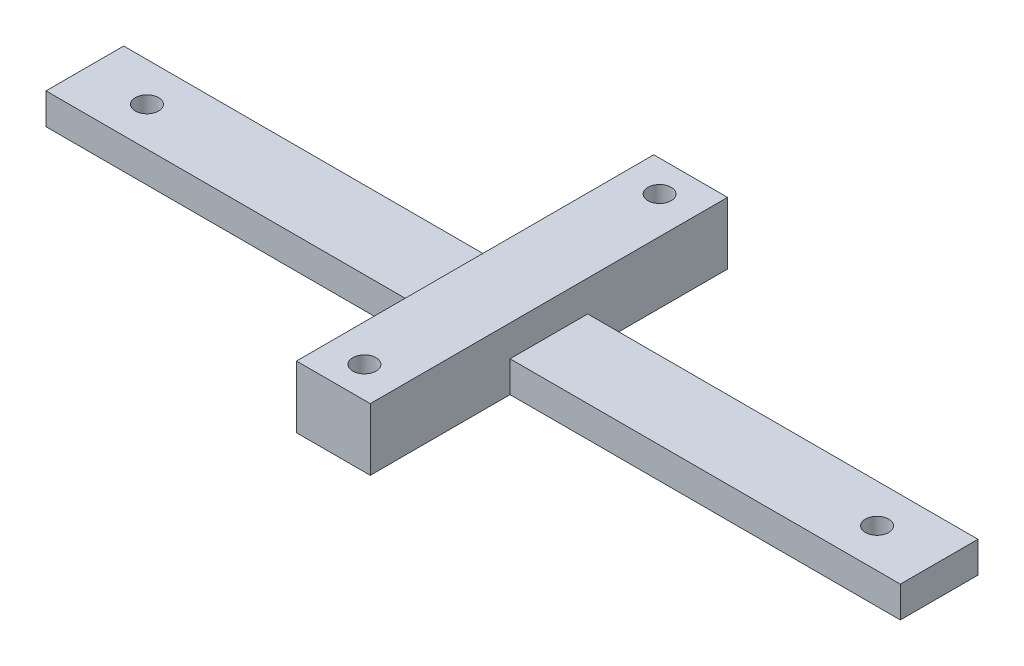
from build123d import *

# Parameters (mm, degrees)
SKETCH1_R           = 1.5
BOSS_EXTRUDE1_DEPTH = 4
SKETCH2_W           = 9.5
SKETCH2_H           = 46
BOSS_EXTRUDE2_DEPTH = 4
SKETCH4_R           = 1.5
CUT_EXTRUDE1_DEPTH  = 9


with BuildPart() as part:
    # Sketch1 → Boss-Extrude1 (new body)
    with BuildSketch(Plane(origin=(0, 0, 0), x_dir=(1, 0, 0), z_dir=(0, 1, 0))):
        Polygon((-4.75, -6.910547932), (-4.75, -24.910547932), (4.75, -24.910547932), (4.75, -6.910547932), (55, -6.910547932), (55, 3.089452068), (4.75, 3.089452068), (4.75, 21.089452068), (-4.75, 21.089452068), (-4.75, 3.089452068), (-55, 3.089452068), (-55, -6.910547932), align=None)
        with Locations((-47, -1.910547932)):
            Circle(SKETCH1_R, mode=Mode.SUBTRACT)
        with Locations((47, -1.910547932)):
            Circle(SKETCH1_R, mode=Mode.SUBTRACT)
    extrude(amount=BOSS_EXTRUDE1_DEPTH)

    # Sketch2 → Boss-Extrude2 (add)
    with BuildSketch(Plane(origin=(0, 4, 0), x_dir=(1, 0, 0), z_dir=(0, 1, 0))):
        with Locations((0, -1.910547932)):
            Rectangle(SKETCH2_W, SKETCH2_H)
    extrude(amount=BOSS_EXTRUDE2_DEPTH)

    # Sketch4 → Cut-Extrude1 (cut)
    with BuildSketch(Plane(origin=(0, 8, 0), x_dir=(1, 0, 0), z_dir=(0, 1, 0))):
        with Locations((0, -20.910547932)):
            Circle(SKETCH4_R)
        with Locations((0, 17.089452068)):
            Circle(SKETCH4_R)
    extrude(amount=-CUT_EXTRUDE1_DEPTH, mode=Mode.SUBTRACT)


solid = part.part
